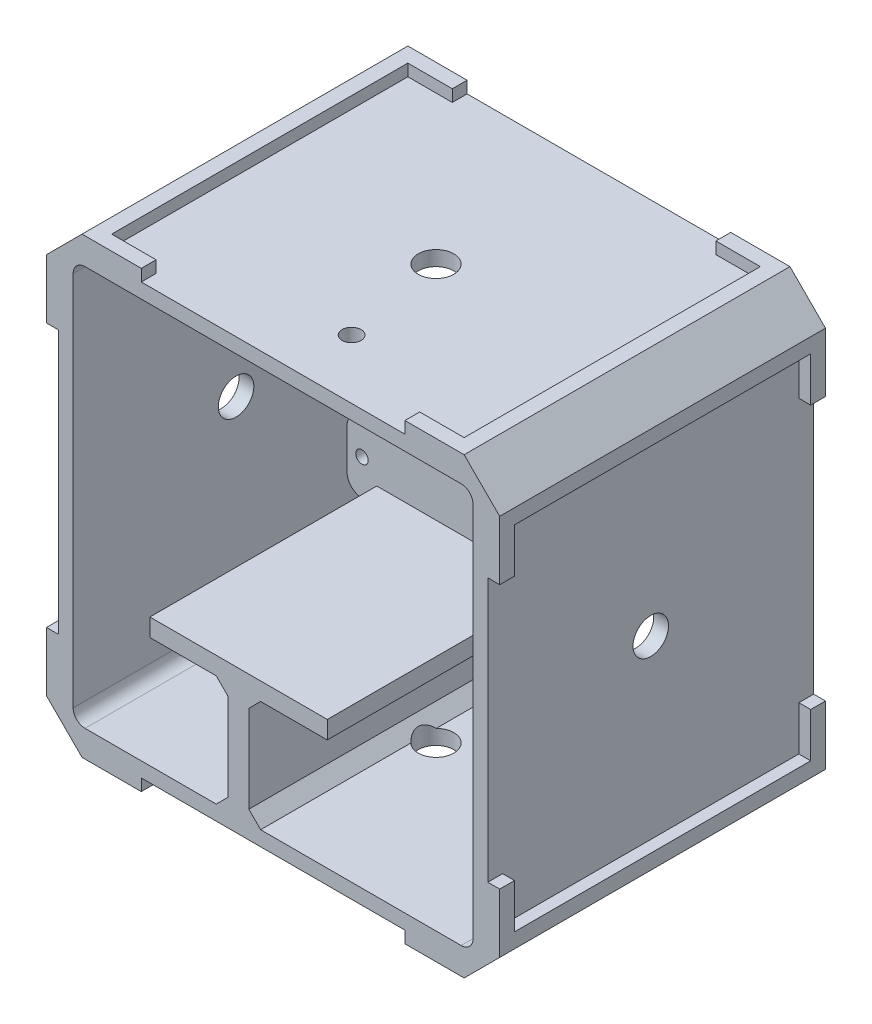
from build123d import *

# Parameters (mm, degrees)
BOSS_EXTRUDE1_DEPTH            = 55
SKETCH2_W                      = 67.5
SKETCH2_H                      = 67.5
BOSS_EXTRUDE2_DEPTH            = 2.5
CUT_EXTRUDE2_REACH             = 77.187
SKETCH4_R                      = 1.65
MIRROR2_COPY_1_REACH           = 77.187
MIRROR2_COPY_1_SKETCH_R        = 1.65
BOSS_EXTRUDE3_DEPTH            = 14.6
BOSS_EXTRUDE3_DEPTH_BACK       = 25.8
BOSS_EXTRUDE4_DEPTH            = 49.7
SKETCH7_W                      = 37.9
SKETCH7_H                      = 22.75
CUT_EXTRUDE3_DEPTH             = 8.4
BOSS_EXTRUDE7_DEPTH            = 2
CUT_EXTRUDE6_REACH             = 84.442
CUT_EXTRUDE6_DIRECTION_2_DEPTH = 83.442009922
CUT_EXTRUDE8_DEPTH             = 103.907106169
CUT_EXTRUDE8_DEPTH_BACK        = 2.5
SKETCH15_R                     = 1.6
SKETCH16_W                     = 7.5
SKETCH16_H                     = 1.65
BOSS_EXTRUDE8_DEPTH            = 7
CUT_EXTRUDE9_REACH             = 74.438
SKETCH17_R                     = 1.05
SKETCH19_R                     = 3
CUT_EXTRUDE10_DEPTH            = 2.5
BOSS_EXTRUDE9_DEPTH            = 2
CIRPATTERN1_COUNT              = 4
CIRPATTERN2_COUNT              = 4
BOSS_EXTRUDE12_DEPTH           = 55
CUT_EXTRUDE12_REACH            = 75.459
SKETCH23_W                     = 6.5
SKETCH23_H                     = 16
FILLET2_R                      = 1.5
CHAMFER1_SIZE                  = 0.75
CUT_EXTRUDE13_REACH            = 91.486
SKETCH25_W                     = 3
SKETCH25_H                     = 35
SKETCH25_W_2                   = 5
SKETCH25_H_2                   = 46.7
FILLET3_R                      = 1.5
SKETCH26_W                     = 12.543976605
SKETCH26_H                     = 9.586128164
CUT_EXTRUDE14_DEPTH            = 90.261665904
SKETCH27_W                     = 6.75
SKETCH27_H                     = 1.4
BOSS_EXTRUDE14_DEPTH           = 1.25
CHAMFER2_SIZE                  = 2
CUT_EXTRUDE15_REACH            = 85.744
SKETCH28_W                     = 7.624106446
SKETCH28_H                     = 46.373052842
FILLET5_R                      = 2.5


with BuildPart() as part:
    # Sketch1 → Boss-Extrude1 (new body)
    with BuildSketch(Plane.XY):
        with BuildLine():
            Line((-36.25, 32.25), (-36.25, -32.25))
            ThreePointArc((-36.25, -32.25), (-35.078427125, -35.078427125), (-32.25, -36.25))
            Line((-32.25, -36.25), (32.25, -36.25))
            ThreePointArc((32.25, -36.25), (35.078427125, -35.078427125), (36.25, -32.25))
            Line((36.25, -32.25), (36.25, 32.25))
            ThreePointArc((36.25, 32.25), (35.078427125, 35.078427125), (32.25, 36.25))
            Line((32.25, 36.25), (-32.25, 36.25))
            ThreePointArc((-32.25, 36.25), (-35.078427125, 35.078427125), (-36.25, 32.25))
        make_face()
        with BuildLine():
            Line((-31.75, 33.75), (31.75, 33.75))
            ThreePointArc((31.75, 33.75), (33.164213562, 33.164213562), (33.75, 31.75))
            Line((33.75, 31.75), (33.75, -31.75))
            ThreePointArc((33.75, -31.75), (33.164213562, -33.164213562), (31.75, -33.75))
            Line((31.75, -33.75), (-31.75, -33.75))
            ThreePointArc((-31.75, -33.75), (-33.164213562, -33.164213562), (-33.75, -31.75))
            Line((-33.75, -31.75), (-33.75, 31.75))
            ThreePointArc((-33.75, 31.75), (-33.164213562, 33.164213562), (-31.75, 33.75))
        make_face(mode=Mode.SUBTRACT)
    extrude(amount=BOSS_EXTRUDE1_DEPTH)

    # Sketch2 → Boss-Extrude2 (add)
    with BuildSketch(Plane.XY):
        Rectangle(SKETCH2_W, SKETCH2_H)
    extrude(amount=BOSS_EXTRUDE2_DEPTH)

    # Sketch4 → Cut-Extrude2 (cut, up to next)
    with BuildSketch(Plane(origin=(0, 0, 0), x_dir=(-1, 0, 0), z_dir=(0, 0, -1)), mode=Mode.PRIVATE) as cut_extrude2_sk1:
        with Locations((-28.75, 28.75)):
            Circle(SKETCH4_R)
    cut_extrude2_tool1 = extrude(cut_extrude2_sk1.sketch, amount=-CUT_EXTRUDE2_REACH, mode=Mode.PRIVATE) & part.part
    cut_extrude2 = cut_extrude2_tool1.solids().sort_by_distance((28.75, 28.75, 0))[0]
    add(cut_extrude2, mode=Mode.SUBTRACT)

    # Mirror1: Cut-Extrude2 across plane
    add(cut_extrude2.mirror(Plane(origin=(0, 0, 0), x_dir=(0, 0, 1), z_dir=(1, 0, 0))), mode=Mode.SUBTRACT)

    # Mirror2: Cut-Extrude2 across plane
    add(cut_extrude2.mirror(Plane.ZX), mode=Mode.SUBTRACT)

    # Mirror2 copy 1 sketch → Mirror2 copy 1 (cut, up to next)
    with BuildSketch(Plane(origin=(0, 0, 0), x_dir=(1, 0, 0), z_dir=(0, 0, -1)), mode=Mode.PRIVATE) as mirror2_copy_1_sk1:
        with Locations((-28.75, 28.75)):
            Circle(MIRROR2_COPY_1_SKETCH_R)
    mirror2_copy_1_tool1 = extrude(mirror2_copy_1_sk1.sketch, amount=-MIRROR2_COPY_1_REACH, mode=Mode.PRIVATE) & part.part
    add(mirror2_copy_1_tool1.solids().sort_by_distance((-28.75, -28.75, 0))[0], mode=Mode.SUBTRACT)



with BuildPart() as body_2:
    # Sketch5 → Boss-Extrude3 (new, two sides: drawn at the far end of the back side and taken through both)
    with BuildSketch(Plane(origin=(0, 0, 0), x_dir=(0, 0, -1), z_dir=(1, 0, 0)).offset(-BOSS_EXTRUDE3_DEPTH_BACK)):
        Polygon((-16.7, 12), (-16.7, -12), (-60.4, -12), (-63.4, -12), (-63.4, -15), (-13.7, -15), (-13.7, 12), align=None)
    extrude(amount=BOSS_EXTRUDE3_DEPTH + BOSS_EXTRUDE3_DEPTH_BACK)


with BuildPart() as part_1:
    add(part.part)

    add(body_2.part)  # Boss-Extrude4 merges body 2
    # Sketch6 → Boss-Extrude4 (add)
    with BuildSketch(Plane.XY.offset(63.4)):
        Polygon((-25.8, -12), (12.1, -12), (12.1, -15), (-4.1, -15), (-4.1, -33.75), (12.1, -33.75), (12.1, -36.25), (-25.8, -36.25), (-25.8, -33.75), (-7.6, -33.75), (-7.6, -15), (-25.8, -15), align=None)
    extrude(amount=-BOSS_EXTRUDE4_DEPTH)

    # Sketch7 → Cut-Extrude3 (cut)
    with BuildSketch(Plane.XY.offset(63.4)):
        with Locations((-6.85, -24.875)):
            Rectangle(SKETCH7_W, SKETCH7_H)
    extrude(amount=-CUT_EXTRUDE3_DEPTH, mode=Mode.SUBTRACT)

    # Sketch12 → Boss-Extrude7 (add)
    with BuildSketch(Plane(origin=(0, 36.25, 0), x_dir=(1, 0, 0), z_dir=(0, 1, 0))):
        Polygon((29.75, -55), (32.25, -55), (32.25, -52.5), (32.25, -45), (29.75, -45), (29.75, -52.5), (22.25, -52.5), (22.25, -55), align=None)
        Polygon((-32.25, 0), (-32.25, -10), (-29.75, -10), (-29.75, -2.5), (-22.25, -2.5), (-22.25, 0), align=None)
    boss_extrude7 = extrude(amount=BOSS_EXTRUDE7_DEPTH)

    # Sketch13 → Cut-Extrude6 (cut, up to next)
    with BuildSketch(Plane(origin=(0, 0, 0), x_dir=(-1, 0, 0), z_dir=(0, 0, -1)), mode=Mode.PRIVATE) as cut_extrude6_sk1:
        with BuildLine():
            Line((-33.75, 21.25), (-25.25, 21.25))
            ThreePointArc((-25.25, 21.25), (-22.421572875, 22.421572875), (-21.25, 25.25))
            Line((-21.25, 25.25), (-21.25, 33.75))
            Line((-21.25, 33.75), (21.25, 33.75))
            Line((21.25, 33.75), (21.25, 25.25))
            ThreePointArc((21.25, 25.25), (22.421572875, 22.421572875), (25.25, 21.25))
            Line((25.25, 21.25), (33.75, 21.25))
            Line((33.75, 21.25), (33.75, -21.25))
            Line((33.75, -21.25), (25.25, -21.25))
            ThreePointArc((25.25, -21.25), (22.421572875, -22.421572875), (21.25, -25.25))
            Line((21.25, -25.25), (21.25, -33.75))
            Line((21.25, -33.75), (-21.25, -33.75))
            Line((-21.25, -33.75), (-21.25, -25.25))
            ThreePointArc((-21.25, -25.25), (-22.421572875, -22.421572875), (-25.25, -21.25))
            Line((-25.25, -21.25), (-33.75, -21.25))
            Line((-33.75, -21.25), (-33.75, 21.25))
        make_face()
    cut_extrude6_tool1 = extrude(cut_extrude6_sk1.sketch, amount=-CUT_EXTRUDE6_REACH, mode=Mode.PRIVATE) & part_1.part
    add(cut_extrude6_tool1.solids().sort_by_distance((0, 0, 0))[0], mode=Mode.SUBTRACT)

    # Sketch13 → Cut-Extrude6 direction 2 (cut)
    with BuildSketch(Plane(origin=(0, 0, 0), x_dir=(-1, 0, 0), z_dir=(0, 0, -1))):
        with BuildLine():
            Line((-33.75, 21.25), (-25.25, 21.25))
            ThreePointArc((-25.25, 21.25), (-22.421572875, 22.421572875), (-21.25, 25.25))
            Line((-21.25, 25.25), (-21.25, 33.75))
            Line((-21.25, 33.75), (21.25, 33.75))
            Line((21.25, 33.75), (21.25, 25.25))
            ThreePointArc((21.25, 25.25), (22.421572875, 22.421572875), (25.25, 21.25))
            Line((25.25, 21.25), (33.75, 21.25))
            Line((33.75, 21.25), (33.75, -21.25))
            Line((33.75, -21.25), (25.25, -21.25))
            ThreePointArc((25.25, -21.25), (22.421572875, -22.421572875), (21.25, -25.25))
            Line((21.25, -25.25), (21.25, -33.75))
            Line((21.25, -33.75), (-21.25, -33.75))
            Line((-21.25, -33.75), (-21.25, -25.25))
            ThreePointArc((-21.25, -25.25), (-22.421572875, -22.421572875), (-25.25, -21.25))
            Line((-25.25, -21.25), (-33.75, -21.25))
            Line((-33.75, -21.25), (-33.75, 21.25))
        make_face()
    extrude(amount=CUT_EXTRUDE6_DIRECTION_2_DEPTH, mode=Mode.SUBTRACT)

    # Sketch15 → Cut-Extrude8 (cut, two sides: drawn at the far end of the back side and taken through both)
    with BuildSketch(Plane(origin=(0, 36.25, 0), x_dir=(1, 0, 0), z_dir=(0, 1, 0)).offset(-CUT_EXTRUDE8_DEPTH_BACK)):
        with Locations(Location((3.25, -45, 0), (0, 0, 90))):
            Circle(SKETCH15_R)
    extrude(amount=CUT_EXTRUDE8_DEPTH + CUT_EXTRUDE8_DEPTH_BACK, mode=Mode.SUBTRACT)

    # Sketch16 → Boss-Extrude8 (add)
    with BuildSketch(Plane(origin=(-33.75, 0, 0), x_dir=(0, 0, -1), z_dir=(1, 0, 0))):
        with Locations((-12.25, 29.525)):
            Rectangle(SKETCH16_W, SKETCH16_H)
    extrude(amount=BOSS_EXTRUDE8_DEPTH)

    # Sketch17 → Cut-Extrude9 (cut, up to next)
    with BuildSketch(Plane(origin=(0, 0, 13.7), x_dir=(-1, 0, 0), z_dir=(0, 0, -1)), mode=Mode.PRIVATE) as cut_extrude9_sk1:
        with Locations(Location((-12.1, 9, 0), (0, 0, 90))):
            Circle(SKETCH17_R)
    cut_extrude9_tool1 = extrude(cut_extrude9_sk1.sketch, amount=-CUT_EXTRUDE9_REACH, mode=Mode.PRIVATE) & part_1.part
    # Sketch17 → Cut-Extrude9 (cut, up to next)
    with BuildSketch(Plane(origin=(0, 0, 13.7), x_dir=(-1, 0, 0), z_dir=(0, 0, -1)), mode=Mode.PRIVATE) as cut_extrude9_sk2:
        with Locations(Location((-12.1, -9, 0), (0, 0, 90))):
            Circle(SKETCH17_R)
    cut_extrude9_tool2 = extrude(cut_extrude9_sk2.sketch, amount=-CUT_EXTRUDE9_REACH, mode=Mode.PRIVATE) & part_1.part
    # Sketch17 → Cut-Extrude9 (cut, up to next)
    with BuildSketch(Plane(origin=(0, 0, 13.7), x_dir=(-1, 0, 0), z_dir=(0, 0, -1)), mode=Mode.PRIVATE) as cut_extrude9_sk3:
        with Locations(Location((23.3, -9, 0), (0, 0, 90))):
            Circle(SKETCH17_R)
    cut_extrude9_tool3 = extrude(cut_extrude9_sk3.sketch, amount=-CUT_EXTRUDE9_REACH, mode=Mode.PRIVATE) & part_1.part
    add(cut_extrude9_tool1.solids().sort_by_distance((12.1, 9, 13.7))[0], mode=Mode.SUBTRACT)
    add(cut_extrude9_tool2.solids().sort_by_distance((12.1, -9, 13.7))[0], mode=Mode.SUBTRACT)
    add(cut_extrude9_tool3.solids().sort_by_distance((-23.3, -9, 13.7))[0], mode=Mode.SUBTRACT)

    # Sketch19 → Cut-Extrude10 (cut)
    with BuildSketch(Plane(origin=(0, 36.25, 0), x_dir=(1, 0, 0), z_dir=(0, 1, 0))):
        with Locations(Location((0, -27.5, 0), (0, 0, 270))):
            Circle(SKETCH19_R)
    cut_extrude10 = extrude(amount=-CUT_EXTRUDE10_DEPTH, mode=Mode.SUBTRACT)

    # Sketch20 → Boss-Extrude9 (add)
    with BuildSketch(Plane(origin=(36.25, 0, -36.25), x_dir=(0, 0, 1), z_dir=(-1, 0, 0))):
        Polygon((91.25, 32.25), (81.25, 32.25), (81.25, 29.75), (88.75, 29.75), (88.75, 22.25), (91.25, 22.25), align=None)
        Polygon((36.25, -22.25), (36.25, -32.25), (46.25, -32.25), (46.25, -29.75), (38.75, -29.75), (38.75, -22.25), align=None)
    boss_extrude9 = extrude(amount=-BOSS_EXTRUDE9_DEPTH)

    # CirPattern1: Boss-Extrude7, Cut-Extrude10 ×4 about axis
    cirpattern1_axis = Axis((0, 0, 0), (0, 0, 1))
    add([boss_extrude7.rotate(cirpattern1_axis, i * 360 / CIRPATTERN1_COUNT) for i in range(1, CIRPATTERN1_COUNT)])
    add([cut_extrude10.rotate(cirpattern1_axis, i * 360 / CIRPATTERN1_COUNT) for i in range(1, CIRPATTERN1_COUNT)], mode=Mode.SUBTRACT)

    # CirPattern2: Boss-Extrude9 ×4 about axis
    cirpattern2_axis = Axis((0, 0, 0), (0, 0, 1))
    for i in range(1, CIRPATTERN2_COUNT):
        add(boss_extrude9.rotate(cirpattern2_axis, i * 360 / CIRPATTERN2_COUNT))

    # Sketch22 → Boss-Extrude12 (add, through all)
    with BuildSketch(Plane.XY.offset(55)):
        Polygon((-38.25, 32.25), (-32.25, 38.25), (-29.75, 38.25), (-29.75, 33.75), (-33.75, 33.75), (-33.75, 29.75), (-38.25, 29.75), align=None)
        Polygon((33.75, 33.75), (33.75, 29.75), (38.25, 29.75), (38.25, 32.25), (32.25, 38.25), (29.75, 38.25), (29.75, 33.75), align=None)
        Polygon((38.25, -32.25), (32.25, -38.25), (29.75, -38.25), (29.75, -33.75), (33.75, -33.75), (33.75, -29.75), (38.25, -29.75), align=None)
        Polygon((-33.75, -33.75), (-33.75, -29.75), (-38.25, -29.75), (-38.25, -32.25), (-32.25, -38.25), (-29.75, -38.25), (-29.75, -33.75), align=None)
    extrude(amount=-BOSS_EXTRUDE12_DEPTH)

    # Sketch23 → Cut-Extrude12 (cut, up to next)
    with BuildSketch(Plane(origin=(0, 0, 13.7), x_dir=(-1, 0, 0), z_dir=(0, 0, -1)), mode=Mode.PRIVATE) as cut_extrude12_sk1:
        with Locations((22.55, 4)):
            Rectangle(SKETCH23_W, SKETCH23_H)
    cut_extrude12_tool1 = extrude(cut_extrude12_sk1.sketch, amount=-CUT_EXTRUDE12_REACH, mode=Mode.PRIVATE) & part_1.part
    add(cut_extrude12_tool1.solids().sort_by_distance((-22.55, 4, 13.7))[0], mode=Mode.SUBTRACT)

    # Fillet2
    fillet2_edges = [part_1.edges().sort_by_distance(p)[0] for p in [
        (14.6, 12, 15.2),
    ]]
    fillet(fillet2_edges, radius=FILLET2_R)

    # Chamfer1
    chamfer1_edges = [part_1.edges().sort_by_distance(p)[0] for p in [
        (-33.75, 28.7, 12.25),
        (-30.25, 30.35, 16),
        (-26.75, 30.35, 12.25),
    ]]
    chamfer(chamfer1_edges, length=CHAMFER1_SIZE)

    # Sketch25 → Cut-Extrude13 (cut, up to next)
    with BuildSketch(Plane(origin=(0, -12, 0), x_dir=(1, 0, 0), z_dir=(0, 1, 0)), mode=Mode.PRIVATE) as cut_extrude13_sk1:
        with Locations((13.1, -45.9)):
            Rectangle(SKETCH25_W, SKETCH25_H)
    cut_extrude13_tool1 = extrude(cut_extrude13_sk1.sketch, amount=-CUT_EXTRUDE13_REACH, mode=Mode.PRIVATE) & part_1.part
    # Sketch25 → Cut-Extrude13 (cut, up to next)
    with BuildSketch(Plane(origin=(0, -12, 0), x_dir=(1, 0, 0), z_dir=(0, 1, 0)), mode=Mode.PRIVATE) as cut_extrude13_sk2:
        with Locations((-23.3, -40.05)):
            Rectangle(SKETCH25_W_2, SKETCH25_H_2)
    cut_extrude13_tool2 = extrude(cut_extrude13_sk2.sketch, amount=-CUT_EXTRUDE13_REACH, mode=Mode.PRIVATE) & part_1.part
    add(cut_extrude13_tool1.solids().sort_by_distance((13.1, -12, 45.9))[0], mode=Mode.SUBTRACT)
    add(cut_extrude13_tool2.solids().sort_by_distance((-23.3, -12, 40.05))[0], mode=Mode.SUBTRACT)

    # Fillet3
    fillet3_edges = [part_1.edges().sort_by_distance(p)[0] for p in [
        (-19.3, -4, 15.2),
        (-19.3, 12, 15.2),
        (-25.8, -4, 15.2),
    ]]
    fillet(fillet3_edges, radius=FILLET3_R)

    # Sketch26 → Cut-Extrude14 (cut, through all)
    with BuildSketch(Plane(origin=(11.6, 0, 0), x_dir=(0, 0, -1), z_dir=(1, 0, 0))):
        with Locations((-61.271988302, -13.249120227)):
            Rectangle(SKETCH26_W, SKETCH26_H)
    extrude(amount=-CUT_EXTRUDE14_DEPTH, mode=Mode.SUBTRACT)

    # Sketch27 → Boss-Extrude14 (add)
    with BuildSketch(Plane(origin=(-33.75, 0, 0), x_dir=(0, 0, -1), z_dir=(1, 0, 0))):
        with Locations((-11.875, 31.05)):
            Rectangle(SKETCH27_W, SKETCH27_H)
    extrude(amount=BOSS_EXTRUDE14_DEPTH)

    # Chamfer2
    # the kernel refuses this chamfer: 2 mm, written as the material it adds along each edge
    with BuildSketch(Plane(origin=(-4.1, -33.75, 13.7), x_dir=(0.9996219169112968, -0.0274958766105856, 0), z_dir=(0, 0, 1))) as chamfer2_piece_1_section:
        Polygon((CHAMFER2_SIZE * 0.999621916911, CHAMFER2_SIZE * 0.0274958766106), (-CHAMFER2_SIZE * 0.0274958766106, CHAMFER2_SIZE * 0.999621916911), (0, 0), align=None)
    chamfer2_piece_1 = extrude(amount=41.3, mode=Mode.PRIVATE)
    chamfer2_piece_1 = chamfer2_piece_1 - Plane(origin=(0, -33.084548952, 27.5), x_dir=(0, 0, 1), z_dir=(0, -1, 0)) * Cylinder(3, 91, mode=Mode.PRIVATE)
    add(chamfer2_piece_1)
    with BuildSketch(Plane(origin=(-4.1, -15, 55), x_dir=(-0.02749587661058651, -0.9996219169112968, 0), z_dir=(0, 0, -1)), Plane(origin=(-7.6, -33.75, 55), x_dir=(0.027495876610586032, 0.9996219169112968, 0), z_dir=(0, 0, -1))) as chamfer2_piece_2:
        Polygon((CHAMFER2_SIZE * 0.999621916911, -CHAMFER2_SIZE * 0.0274958766106), (-CHAMFER2_SIZE * 0.0274958766106, -CHAMFER2_SIZE * 0.999621916911), (0, 0), align=None)
    extrude(amount=41.3)
    with BuildSketch(Plane(origin=(-7.6, -15, 55), x_dir=(0.02749587661058699, -0.9996219169112968, 0), z_dir=(0, 0, -1))) as chamfer2_piece_3:
        Polygon((CHAMFER2_SIZE * 0.999621916911, CHAMFER2_SIZE * 0.0274958766106), (-CHAMFER2_SIZE * 0.0274958766106, CHAMFER2_SIZE * 0.999621916911), (0, 0), align=None)
    extrude(amount=41.3)

    # Sketch28 → Cut-Extrude15 (cut, up to next)
    with BuildSketch(Plane(origin=(0, -12, 0), x_dir=(1, 0, 0), z_dir=(0, 1, 0)), mode=Mode.PRIVATE) as cut_extrude15_sk1:
        with Locations((12.962053223, -39.886526421)):
            Rectangle(SKETCH28_W, SKETCH28_H)
    cut_extrude15_tool1 = extrude(cut_extrude15_sk1.sketch, amount=-CUT_EXTRUDE15_REACH, mode=Mode.PRIVATE) & part_1.part
    add(cut_extrude15_tool1.solids().sort_by_distance((12.962053, -12, 39.886526))[0], mode=Mode.SUBTRACT)

    # Fillet5
    fillet5_edges = [part_1.edges().sort_by_distance(p)[0] for p in [
        (14.6, -15, 15.2),
        (-25.8, -15, 15.2),
    ]]
    fillet(fillet5_edges, radius=FILLET5_R)


solid = part_1.part
